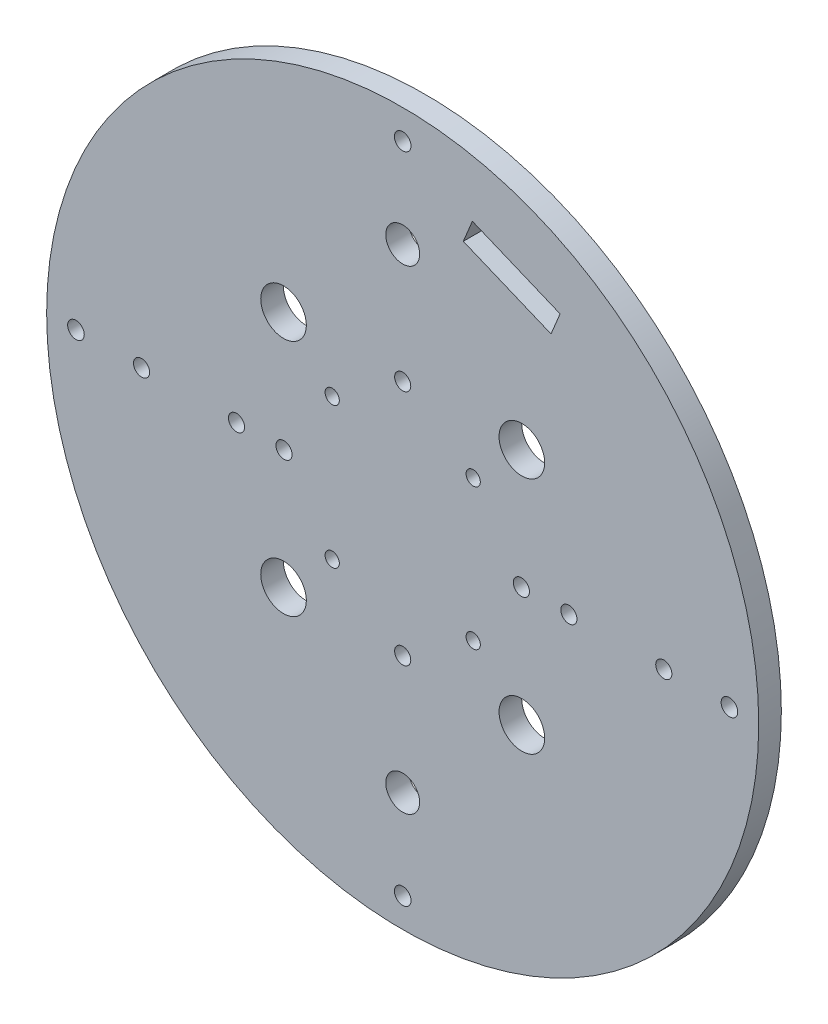
from build123d import *

# Parameters (mm, degrees)
SKETCH2_R           = 75
SKETCH2_R_2         = 3.5687
SKETCH2_R_3         = 4.8
BOSS_EXTRUDE1_DEPTH = 4.7625
SKETCH3_R           = 1.5
CUT_EXTRUDE1_DEPTH  = 107.172884515
SKETCH4_R           = 1.7
CUT_EXTRUDE2_DEPTH  = 107.172884515
SKETCH5_R           = 1.7
CUT_EXTRUDE3_DEPTH  = 107.172884515
SKETCH6_R           = 1.75
CUT_EXTRUDE4_DEPTH  = 107.172884515
SKETCH7_R           = 3.25
SKETCH7_R_2         = 1.7272
BOSS_EXTRUDE2_DEPTH = 10
CUT_EXTRUDE5_DEPTH  = 10


# Read off the part's stored shape, not the designer's step: Draft1
with BuildPart() as part:
    # Sketch2 → Boss-Extrude1 (new body)
    with BuildSketch(Plane.XY.offset(157.1625)):
        with Locations(Location((0, 0, 0), (0, 0, 180))):
            Circle(SKETCH2_R)
        with Locations(Location((0, 50, 0), (0, 0, 180))):
            Circle(SKETCH2_R_2, mode=Mode.SUBTRACT)
        with Locations(Location((0, -50, 0), (0, 0, 180))):
            Circle(SKETCH2_R_2, mode=Mode.SUBTRACT)
        with Locations(Location((25.102290732, 25.102290732, 0), (0, 0, 180))):
            Circle(SKETCH2_R_3, mode=Mode.SUBTRACT)
        with Locations(Location((-25.102290732, 25.102290732, 0), (0, 0, 180))):
            Circle(SKETCH2_R_3, mode=Mode.SUBTRACT)
        with Locations(Location((-25.102290732, -25.102290732, 0), (0, 0, 180))):
            Circle(SKETCH2_R_3, mode=Mode.SUBTRACT)
        with Locations(Location((25.102290732, -25.102290732, 0), (0, 0, 180))):
            Circle(SKETCH2_R_3, mode=Mode.SUBTRACT)
    extrude(amount=BOSS_EXTRUDE1_DEPTH)

    # Sketch3 → Cut-Extrude1 (cut, through all)
    with BuildSketch(Plane.XY.offset(161.925)):
        with Locations((14.849242405, 14.849242405)):
            Circle(SKETCH3_R)
        with Locations((-14.849242405, 14.849242405)):
            Circle(SKETCH3_R)
        with Locations((-14.849242405, -14.849242405)):
            Circle(SKETCH3_R)
        with Locations((14.849242405, -14.849242405)):
            Circle(SKETCH3_R)
    extrude(amount=-CUT_EXTRUDE1_DEPTH, mode=Mode.SUBTRACT)

    # Sketch4 → Cut-Extrude2 (cut, through all)
    with BuildSketch(Plane.XY.offset(161.925)):
        with Locations((0, 25)):
            Circle(SKETCH4_R)
        with Locations((25, 0)):
            Circle(SKETCH4_R)
        with Locations((0, -25)):
            Circle(SKETCH4_R)
        with Locations((-25, 0)):
            Circle(SKETCH4_R)
    extrude(amount=-CUT_EXTRUDE2_DEPTH, mode=Mode.SUBTRACT)

    # Sketch5 → Cut-Extrude3 (cut, through all)
    with BuildSketch(Plane.XY.offset(161.925)):
        with Locations((-35, 0)):
            Circle(SKETCH5_R)
        with Locations((-55, 0)):
            Circle(SKETCH5_R)
        with Locations((35, 0)):
            Circle(SKETCH5_R)
        with Locations((55, 0)):
            Circle(SKETCH5_R)
    extrude(amount=-CUT_EXTRUDE3_DEPTH, mode=Mode.SUBTRACT)

    # Sketch6 → Cut-Extrude4 (cut, through all)
    with BuildSketch(Plane.XY.offset(161.925)):
        with Locations((0, 68.825)):
            Circle(SKETCH6_R)
        with Locations((68.825, 0)):
            Circle(SKETCH6_R)
        with Locations((0, -68.825)):
            Circle(SKETCH6_R)
        with Locations((-68.825, 0)):
            Circle(SKETCH6_R)
    extrude(amount=-CUT_EXTRUDE4_DEPTH, mode=Mode.SUBTRACT)

    # Sketch7 → Boss-Extrude2 (add)
    # profile 1 of 4: a face of its own
    with BuildSketch(Plane(origin=(0, 0, 157.1625), x_dir=(-1, 0, 0), z_dir=(0, 0, -1))):
        with Locations(Location((7.424621202, -7.424621202, 0), (0, 0, 180))):
            Circle(SKETCH7_R)
        with Locations((7.424621202, -7.424621202)):
            Circle(SKETCH7_R_2, mode=Mode.SUBTRACT)
    # profile 2 of 4: a face of its own
    with BuildSketch(Plane(origin=(0, 0, 157.1625), x_dir=(-1, 0, 0), z_dir=(0, 0, -1))):
        with Locations(Location((7.424621202, 7.424621202, 0), (0, 0, 180))):
            Circle(SKETCH7_R)
        with Locations((7.424621202, 7.424621202)):
            Circle(SKETCH7_R_2, mode=Mode.SUBTRACT)
    # profile 3 of 4: a face of its own
    with BuildSketch(Plane(origin=(0, 0, 157.1625), x_dir=(-1, 0, 0), z_dir=(0, 0, -1))):
        with Locations(Location((-7.424621202, 7.424621202, 0), (0, 0, 180))):
            Circle(SKETCH7_R)
        with Locations((-7.424621202, 7.424621202)):
            Circle(SKETCH7_R_2, mode=Mode.SUBTRACT)
    # profile 4 of 4: a face of its own
    with BuildSketch(Plane(origin=(0, 0, 157.1625), x_dir=(-1, 0, 0), z_dir=(0, 0, -1))):
        with Locations(Location((-7.424621202, -7.424621202, 0), (0, 0, 180))):
            Circle(SKETCH7_R)
        with Locations((-7.424621202, -7.424621202)):
            Circle(SKETCH7_R_2, mode=Mode.SUBTRACT)
    extrude(amount=BOSS_EXTRUDE2_DEPTH)

    # Sketch8 → Cut-Extrude5 (cut)
    with BuildSketch(Plane(origin=(0, 0, 157.1625), x_dir=(-1, 0, 0), z_dir=(0, 0, -1))):
        Polygon((-12.765502036, 56.949907443), (-31.243092686, 49.296238796), (-33.156509848, 53.915636458), (-14.678919198, 61.569305106), align=None)
    extrude(amount=-CUT_EXTRUDE5_DEPTH, mode=Mode.SUBTRACT)

    # Draft1 outline → Draft1 (revolve)
    with BuildSketch(Plane(origin=(-7.424621202, -7.424621202, 0), x_dir=(1, 0, 0), z_dir=(0, -1, 0))):
        Polygon((3.25, 157.1625), (3.25, 147.1625), (5.929491924, 157.1625), align=None)
    revolve(axis=Axis((-7.424621202, -7.424621202, 0), (0, 0, 1)))

    # Draft1 2 outline → Draft1 2 (revolve)
    with BuildSketch(Plane(origin=(-7.424621202, 7.424621202, 0), x_dir=(1, 0, 0), z_dir=(0, -1, 0))):
        Polygon((3.25, 157.1625), (3.25, 147.1625), (5.929491924, 157.1625), align=None)
    revolve(axis=Axis((-7.424621202, 7.424621202, 0), (0, 0, 1)))

    # Draft1 3 outline → Draft1 3 (revolve)
    with BuildSketch(Plane(origin=(7.424621202, 7.424621202, 0), x_dir=(1, 0, 0), z_dir=(0, -1, 0))):
        Polygon((3.25, 157.1625), (3.25, 147.1625), (5.929491924, 157.1625), align=None)
    revolve(axis=Axis((7.424621202, 7.424621202, 0), (0, 0, 1)))

    # Draft1 4 outline → Draft1 4 (revolve)
    with BuildSketch(Plane(origin=(7.424621202, -7.424621202, 0), x_dir=(1, 0, 0), z_dir=(0, -1, 0))):
        Polygon((3.25, 157.1625), (3.25, 147.1625), (5.929491924, 157.1625), align=None)
    revolve(axis=Axis((7.424621202, -7.424621202, 0), (0, 0, 1)))


solid = part.part
